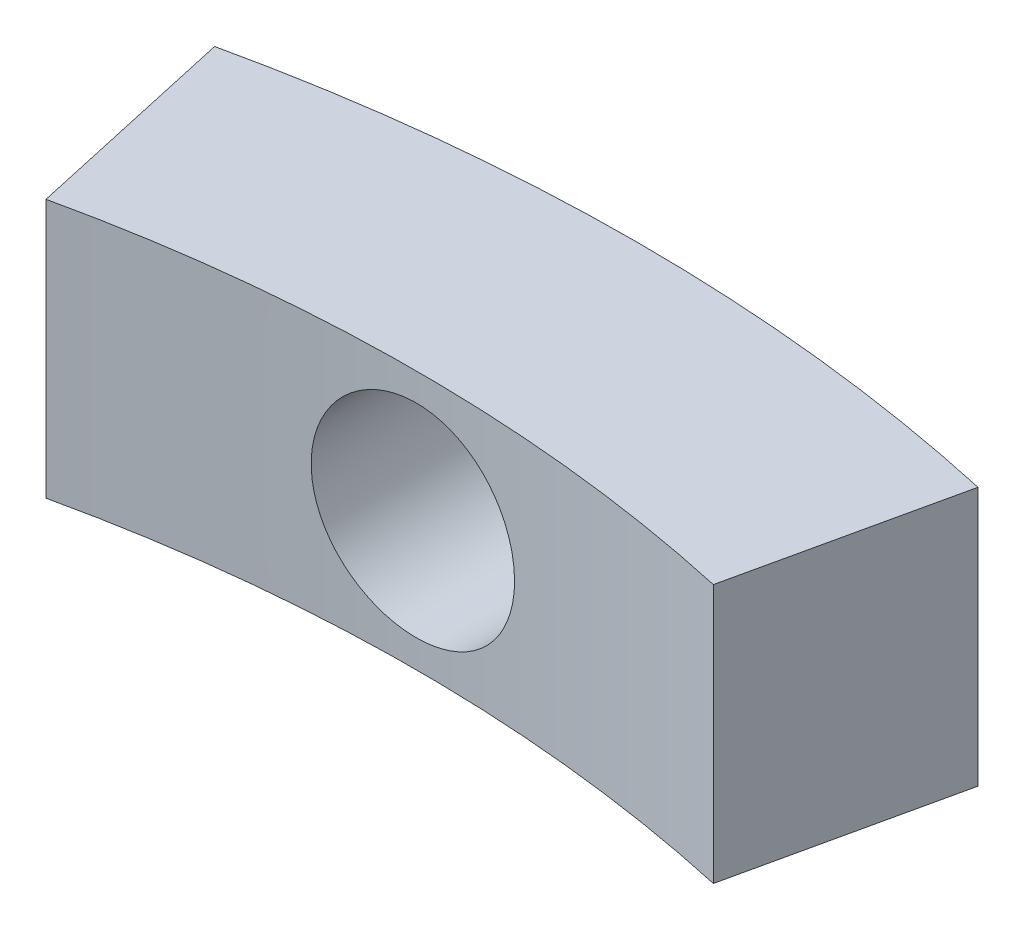
from build123d import *

# Parameters (mm, degrees)
BOSS_EXTRUDE1_DEPTH     = 3.499999985
CUT_EXTRUDE3_DEPTH      = 13.946883884
CUT_EXTRUDE3_DEPTH_BACK = 13.946883884
SKETCH3_R               = 2.749999961


with BuildPart() as part:
    # Sketch2 → Boss-Extrude1 (new, symmetric)
    with BuildSketch(Plane(origin=(0, 0, 0), x_dir=(1, 0, 0), z_dir=(0, 1, 0))):
        with BuildLine():
            Line((-10.321680529, -1.130407864), (-9.023042859, -6.988183847))
            ThreePointArc((-9.023042859, -6.988183847), (0, -5.999999938), (9.023042859, -6.988183847))
            Line((9.023042859, -6.988183847), (10.321680529, -1.130407864))
            ThreePointArc((10.321680529, -1.130407864), (0, 0), (-10.321680529, -1.130407864))
        make_face()
    extrude(amount=BOSS_EXTRUDE1_DEPTH, both=True)

    # Sketch3 → Cut-Extrude3 (cut, two sides: drawn at the far end of the back side and taken through both)
    with BuildSketch(Plane.XY.offset(-CUT_EXTRUDE3_DEPTH_BACK)):
        Circle(SKETCH3_R)
    extrude(amount=CUT_EXTRUDE3_DEPTH + CUT_EXTRUDE3_DEPTH_BACK, mode=Mode.SUBTRACT)


solid = part.part
